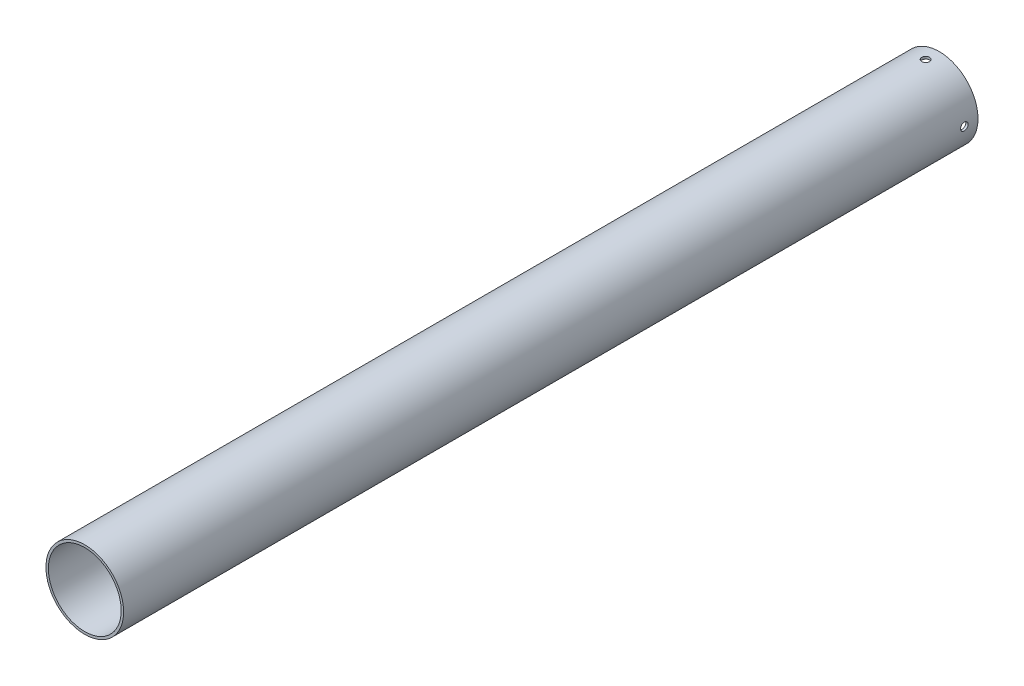
from build123d import *

# Parameters (mm, degrees)
SKETCH1_R               = 25.4
SKETCH1_R_2             = 23.8125
BOSS_EXTRUDE1_DEPTH     = 279.358506179
CUT_EXTRUDE1_DEPTH      = 282.658472222
CUT_EXTRUDE1_DEPTH_BACK = 282.658472222
SKETCH2_R               = 2.4892
CUT_EXTRUDE2_DEPTH      = 282.658472339
CUT_EXTRUDE2_DEPTH_BACK = 282.658472339
SKETCH3_R               = 2.4892


with BuildPart() as part:
    # Sketch1 → Boss-Extrude1 (new, symmetric)
    with BuildSketch(Plane.XY):
        Circle(SKETCH1_R)
        Circle(SKETCH1_R_2, mode=Mode.SUBTRACT)
    extrude(amount=BOSS_EXTRUDE1_DEPTH, both=True)

    # Sketch2 → Cut-Extrude1 (cut, two sides: drawn at the far end of the back side and taken through both)
    with BuildSketch(Plane(origin=(0, 0, 0), x_dir=(0, 0, -1), z_dir=(1, 0, 0)).offset(-CUT_EXTRUDE1_DEPTH_BACK)):
        with Locations((270.468506179, 0)):
            Circle(SKETCH2_R)
    extrude(amount=CUT_EXTRUDE1_DEPTH + CUT_EXTRUDE1_DEPTH_BACK, mode=Mode.SUBTRACT)

    # Sketch3 → Cut-Extrude2 (cut, two sides: drawn at the far end of the back side and taken through both)
    with BuildSketch(Plane(origin=(0, 0, 0), x_dir=(1, 0, 0), z_dir=(0, 1, 0)).offset(-CUT_EXTRUDE2_DEPTH_BACK)):
        with Locations((0, 270.468506179)):
            Circle(SKETCH3_R)
    extrude(amount=CUT_EXTRUDE2_DEPTH + CUT_EXTRUDE2_DEPTH_BACK, mode=Mode.SUBTRACT)


solid = part.part
